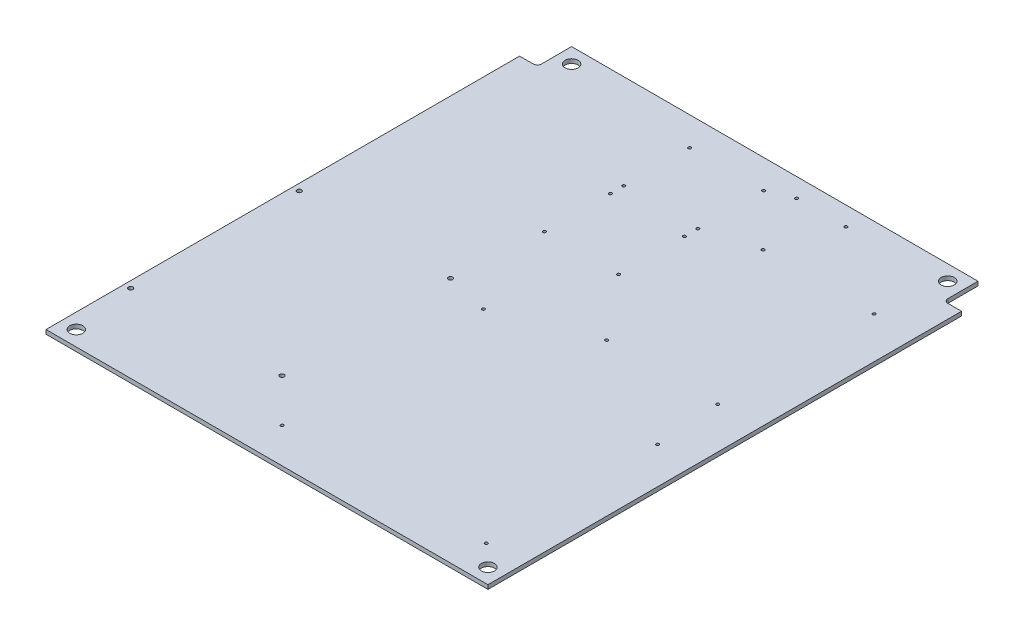
from build123d import *

# Parameters (mm, degrees)
SKETCH1_W                   = 340.868
SKETCH1_H                   = 391.668
BOSS_EXTRUDE1_DEPTH         = 3.175
CUT_EXTRUDE1_DEPTH          = 10
F_3_8_CLEARANCE_HOLE1_D     = 10.0838
F_3_8_CLEARANCE_HOLE1_DEPTH = 18.75
F_3_8_CLEARANCE_HOLE1_TIP   = 3.029479155
F_4_40_TAPPED_HOLE1_D       = 2.2606
F_4_40_TAPPED_HOLE1_DEPTH   = 7.6
F_4_40_TAPPED_HOLE1_TIP     = 0.679152758
F_8_32_TAPPED_HOLE1_D       = 3.4544
F_8_32_TAPPED_HOLE1_DEPTH   = 10.71
F_8_32_TAPPED_HOLE1_TIP     = 1.037806461
F_4_40_TAPPED_HOLE2_D       = 2.2606
F_4_40_TAPPED_HOLE2_DEPTH   = 7.6
F_4_40_TAPPED_HOLE2_TIP     = 0.679152758
F_4_40_TAPPED_HOLE3_D       = 2.2606
F_4_40_TAPPED_HOLE3_DEPTH   = 7.6
F_4_40_TAPPED_HOLE3_TIP     = 0.679152758


with BuildPart() as part:
    # Sketch1 → Boss-Extrude1 (new body)
    with BuildSketch(Plane(origin=(0, 0, 0), x_dir=(1, 0, 0), z_dir=(0, 1, 0))):
        Rectangle(SKETCH1_W, SKETCH1_H)
    extrude(amount=BOSS_EXTRUDE1_DEPTH)

    # Sketch2 → Cut-Extrude1 (cut)
    with BuildSketch(Plane(origin=(0, 3.175, 0), x_dir=(1, 0, 0), z_dir=(0, 1, 0))):
        with BuildLine():
            Line((-170.434, 195.834), (-156.718, 195.834))
            Line((-156.718, 195.834), (-156.718, 172.593))
            ThreePointArc((-156.718, 172.593), (-157.64793597, 170.34793597), (-159.893, 169.418))
            Line((-159.893, 169.418), (-170.434, 169.418))
            Line((-170.434, 169.418), (-170.434, 195.834))
        make_face()
        with BuildLine():
            Line((170.434, 195.834), (156.718, 195.834))
            Line((156.718, 195.834), (156.718, 172.593))
            ThreePointArc((156.718, 172.593), (157.64793597, 170.34793597), (159.893, 169.418))
            Line((159.893, 169.418), (170.434, 169.418))
            Line((170.434, 169.418), (170.434, 195.834))
        make_face()
    extrude(amount=-CUT_EXTRUDE1_DEPTH, mode=Mode.SUBTRACT)

    # 3/8 Clearance Hole1
    with Locations(Plane(origin=(0, 3.175, 0), x_dir=(1, 0, 0), z_dir=(0, 1, 0))):
        with Locations((158.75, -184.15), (-158.75, -184.15), (-145.034, 184.15), (145.034, 184.15)):
            Hole(F_3_8_CLEARANCE_HOLE1_D / 2, depth=F_3_8_CLEARANCE_HOLE1_DEPTH)
            with Locations((0, 0, -(F_3_8_CLEARANCE_HOLE1_DEPTH + F_3_8_CLEARANCE_HOLE1_TIP / 2))):  # 118° drill point
                Cone(0, F_3_8_CLEARANCE_HOLE1_D / 2, F_3_8_CLEARANCE_HOLE1_TIP, mode=Mode.SUBTRACT)

    # #4-40 Tapped Hole1
    with Locations(Plane(origin=(0, 3.175, 0), x_dir=(1, 0, 0), z_dir=(0, 1, 0))):
        with Locations((-15.34, -13.51), (142.14, -36.73), (142.14, -168.81), (-15.34, -168.81), (-43.575, 61.759), (13.575, 61.759), (13.575, 112.559), (-43.575, 112.559), (-43.575, 122.909), (-43.575, 173.709), (13.575, 173.709), (13.575, 122.909)):
            Hole(F_4_40_TAPPED_HOLE1_D / 2, depth=F_4_40_TAPPED_HOLE1_DEPTH)
            with Locations((0, 0, -(F_4_40_TAPPED_HOLE1_DEPTH + F_4_40_TAPPED_HOLE1_TIP / 2))):  # 118° drill point
                Cone(0, F_4_40_TAPPED_HOLE1_D / 2, F_4_40_TAPPED_HOLE1_TIP, mode=Mode.SUBTRACT)

    # #8-32 Tapped Hole1
    with Locations(Plane(origin=(0, 3.175, 0), x_dir=(1, 0, 0), z_dir=(0, 1, 0))):
        with Locations((-165.334, -5.625), (-165.334, -135.625), (-48.634, -135.625), (-48.634, -5.625)):
            Hole(F_8_32_TAPPED_HOLE1_D / 2, depth=F_8_32_TAPPED_HOLE1_DEPTH)
            with Locations((0, 0, -(F_8_32_TAPPED_HOLE1_DEPTH + F_8_32_TAPPED_HOLE1_TIP / 2))):  # 118° drill point
                Cone(0, F_8_32_TAPPED_HOLE1_D / 2, F_8_32_TAPPED_HOLE1_TIP, mode=Mode.SUBTRACT)

    # #4-40 Tapped Hole2
    with Locations(Plane(origin=(0, 3.175, 0), x_dir=(1, 0, 0), z_dir=(0, 1, 0))):
        with Locations((138.509, 13.259), (52.859, 13.259), (138.509, 133.909), (52.859, 133.909)):
            Hole(F_4_40_TAPPED_HOLE2_D / 2, depth=F_4_40_TAPPED_HOLE2_DEPTH)
            with Locations((0, 0, -(F_4_40_TAPPED_HOLE2_DEPTH + F_4_40_TAPPED_HOLE2_TIP / 2))):  # 118° drill point
                Cone(0, F_4_40_TAPPED_HOLE2_D / 2, F_4_40_TAPPED_HOLE2_TIP, mode=Mode.SUBTRACT)

    # #4-40 Tapped Hole3
    with Locations(Plane(origin=(0, 3.175, 0), x_dir=(1, 0, 0), z_dir=(0, 1, 0))):
        with Locations((69.434, 181.209), (31.434, 181.209)):
            Hole(F_4_40_TAPPED_HOLE3_D / 2, depth=F_4_40_TAPPED_HOLE3_DEPTH)
            with Locations((0, 0, -(F_4_40_TAPPED_HOLE3_DEPTH + F_4_40_TAPPED_HOLE3_TIP / 2))):  # 118° drill point
                Cone(0, F_4_40_TAPPED_HOLE3_D / 2, F_4_40_TAPPED_HOLE3_TIP, mode=Mode.SUBTRACT)


solid = part.part
